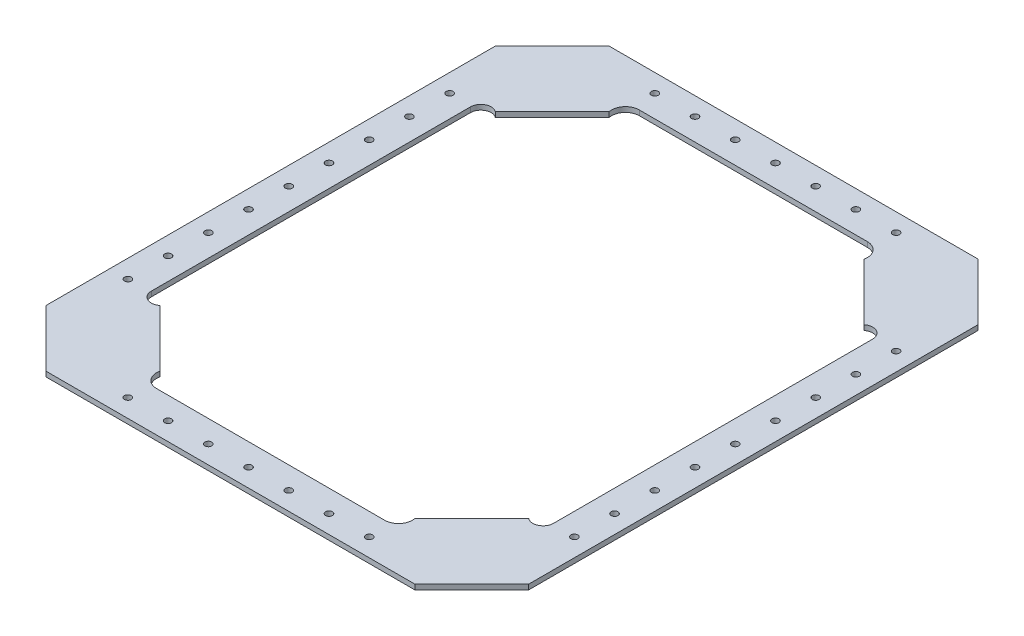
from build123d import *

# Parameters (mm, degrees)
BOSS_EXTRUDE1_DEPTH = 3.175
CUT_EXTRUDE1_DEPTH  = 252.960239461
BOSS_EXTRUDE2_DEPTH = 3.175
SKETCH4_R           = 2.159
CUT_EXTRUDE2_DEPTH  = 252.960239461
SKETCH6_W           = 254
SKETCH6_H           = 106.880400145
CUT_EXTRUDE3_DEPTH  = 252.960239461


with BuildPart() as part:
    # Sketch1 → Boss-Extrude1 (new body)
    with BuildSketch(Plane(origin=(0, 0, 0), x_dir=(1, 0, 0), z_dir=(0, 1, 0))):
        Polygon((-152.4, 119.059630377), (-116.478975516, 154.980654861), (116.478975516, 154.980654861), (152.4, 119.059630377), (152.4, -164.698320655), (116.478975516, -200.619345139), (-116.478975516, -200.619345139), (-152.4, -164.698320655), align=None)
    extrude(amount=BOSS_EXTRUDE1_DEPTH)

    # Sketch2 → Cut-Extrude1 (cut, through all)
    with BuildSketch(Plane(origin=(0, 3.175, 0), x_dir=(1, 0, 0), z_dir=(0, 1, 0))):
        Polygon((-91.078975516, 129.580654861), (91.078975516, 129.580654861), (127, 93.659630377), (127, 8.930654861), (82.442975516, 8.930654861), (-74.314975516, 8.930654861), (-127, 8.930654861), (-127, 93.659630377), align=None)
        Polygon((127, -139.298320655), (91.078975516, -175.219345139), (-91.078975516, -175.219345139), (-127, -139.298320655), (-127, -54.569345139), (-74.314975516, -54.569345139), (82.442975516, -54.569345139), (127, -54.569345139), align=None)
    extrude(amount=-CUT_EXTRUDE1_DEPTH, mode=Mode.SUBTRACT)

    # Sketch5 → Boss-Extrude2 (add)
    with BuildSketch(Plane(origin=(0, 3.175, 0), x_dir=(1, 0, 0), z_dir=(0, 1, 0))):
        with BuildLine():
            Line((-116.478975516, 83.138605892), (-80.557951031, 119.059630377))
            ThreePointArc((-80.557951031, 119.059630377), (-78.800891411, 126.352814743), (-72.028975516, 129.580654861))
            Line((-72.028975516, 129.580654861), (-59.328975516, 129.580654861))
            Line((-59.328975516, 129.580654861), (-59.328975516, 154.980654861))
            Line((-59.328975516, 154.980654861), (-116.478975516, 154.980654861))
            Line((-116.478975516, 154.980654861), (-152.4, 119.059630377))
            Line((-152.4, 119.059630377), (-152.4, 65.258187686))
            Line((-152.4, 65.258187686), (-127, 65.258187686))
            Line((-127, 65.258187686), (-127, 77.958187686))
            ThreePointArc((-127, 77.958187686), (-123.351279088, 83.821819005), (-116.478975516, 83.138605892))
        make_face()
        with BuildLine():
            Line((127, 65.258187686), (127, 77.958187686))
            ThreePointArc((127, 77.958187686), (123.351279088, 83.821819005), (116.478975516, 83.138605892))
            Line((116.478975516, 83.138605892), (80.557951031, 119.059630377))
            ThreePointArc((80.557951031, 119.059630377), (78.800891411, 126.352814743), (72.028975516, 129.580654861))
            Line((72.028975516, 129.580654861), (59.328975516, 129.580654861))
            Line((59.328975516, 129.580654861), (59.328975516, 154.980654861))
            Line((59.328975516, 154.980654861), (116.478975516, 154.980654861))
            Line((116.478975516, 154.980654861), (152.4, 119.059630377))
            Line((152.4, 119.059630377), (152.4, 65.258187686))
            Line((152.4, 65.258187686), (127, 65.258187686))
        make_face()
        with BuildLine():
            Line((116.478975516, -128.777296171), (80.557951031, -164.698320655))
            ThreePointArc((80.557951031, -164.698320655), (78.800891411, -171.991505021), (72.028975516, -175.219345139))
            Line((72.028975516, -175.219345139), (59.328975516, -175.219345139))
            Line((59.328975516, -175.219345139), (59.328975516, -200.619345139))
            Line((59.328975516, -200.619345139), (116.478975516, -200.619345139))
            Line((116.478975516, -200.619345139), (152.4, -164.698320655))
            Line((152.4, -164.698320655), (152.4, -110.896877964))
            Line((152.4, -110.896877964), (127, -110.896877964))
            Line((127, -110.896877964), (127, -123.596877964))
            ThreePointArc((127, -123.596877964), (123.351279088, -129.460509283), (116.478975516, -128.777296171))
        make_face()
        with BuildLine():
            Line((-127, -110.896877964), (-127, -123.596877964))
            ThreePointArc((-127, -123.596877964), (-123.351279088, -129.460509283), (-116.478975516, -128.777296171))
            Line((-116.478975516, -128.777296171), (-80.557951031, -164.698320655))
            ThreePointArc((-80.557951031, -164.698320655), (-78.800891411, -171.991505021), (-72.028975516, -175.219345139))
            Line((-72.028975516, -175.219345139), (-59.328975516, -175.219345139))
            Line((-59.328975516, -175.219345139), (-59.328975516, -200.619345139))
            Line((-59.328975516, -200.619345139), (-116.478975516, -200.619345139))
            Line((-116.478975516, -200.619345139), (-152.4, -164.698320655))
            Line((-152.4, -164.698320655), (-152.4, -110.896877964))
            Line((-152.4, -110.896877964), (-127, -110.896877964))
        make_face()
    extrude(amount=-BOSS_EXTRUDE2_DEPTH)

    # Sketch4 → Cut-Extrude2 (cut, through all)
    with BuildSketch(Plane(origin=(0, 3.175, 0), x_dir=(1, 0, 0), z_dir=(0, 1, 0))):
        with Locations((0, 143.550654861)):
            Circle(SKETCH4_R)
        with Locations((-50.8, 143.550654861)):
            Circle(SKETCH4_R)
        with Locations((50.8, 143.550654861)):
            Circle(SKETCH4_R)
        with Locations((-25.4, 143.550654861)):
            Circle(SKETCH4_R)
        with Locations((25.4, 143.550654861)):
            Circle(SKETCH4_R)
        with Locations((-140.97, -22.819345139)):
            Circle(SKETCH4_R)
        with Locations((-140.97, 2.580654861)):
            Circle(SKETCH4_R)
        with Locations((-140.97, 27.980654861)):
            Circle(SKETCH4_R)
        with Locations((140.97, -22.819345139)):
            Circle(SKETCH4_R)
        with Locations((140.97, 2.580654861)):
            Circle(SKETCH4_R)
        with Locations((140.97, 27.980654861)):
            Circle(SKETCH4_R)
        with Locations((140.97, -73.619345139)):
            Circle(SKETCH4_R)
        with Locations((140.97, -48.219345139)):
            Circle(SKETCH4_R)
        with Locations((-140.97, -73.619345139)):
            Circle(SKETCH4_R)
        with Locations((-140.97, -48.219345139)):
            Circle(SKETCH4_R)
        with Locations((25.4, -189.189345139)):
            Circle(SKETCH4_R)
        with Locations((-25.4, -189.189345139)):
            Circle(SKETCH4_R)
        with Locations((50.8, -189.189345139)):
            Circle(SKETCH4_R)
        with Locations((-50.8, -189.189345139)):
            Circle(SKETCH4_R)
        with Locations((0, -189.189345139)):
            Circle(SKETCH4_R)
        with Locations((-76.2, 143.550654861)):
            Circle(SKETCH4_R)
        with Locations((76.2, 143.550654861)):
            Circle(SKETCH4_R)
        with Locations((-140.97, 53.380654861)):
            Circle(SKETCH4_R)
        with Locations((140.97, 53.380654861)):
            Circle(SKETCH4_R)
        with Locations((140.97, -99.019345139)):
            Circle(SKETCH4_R)
        with Locations((76.2, -189.189345139)):
            Circle(SKETCH4_R)
        with Locations((-76.2, -189.189345139)):
            Circle(SKETCH4_R)
        with Locations((-140.97, -99.019345139)):
            Circle(SKETCH4_R)
        with Locations((-140.97, -124.419345139)):
            Circle(SKETCH4_R)
        with Locations((-140.97, 78.780654861)):
            Circle(SKETCH4_R)
        with Locations((140.97, 78.780654861)):
            Circle(SKETCH4_R)
        with Locations((140.97, -124.419345139)):
            Circle(SKETCH4_R)
    extrude(amount=-CUT_EXTRUDE2_DEPTH, mode=Mode.SUBTRACT)

    # Sketch6 → Cut-Extrude3 (cut, through all)
    with BuildSketch(Plane(origin=(0, 3.175, 0), x_dir=(1, 0, 0), z_dir=(0, 1, 0))):
        with Locations((0, -26.175268273)):
            Rectangle(SKETCH6_W, SKETCH6_H)
    extrude(amount=-CUT_EXTRUDE3_DEPTH, mode=Mode.SUBTRACT)


solid = part.part
